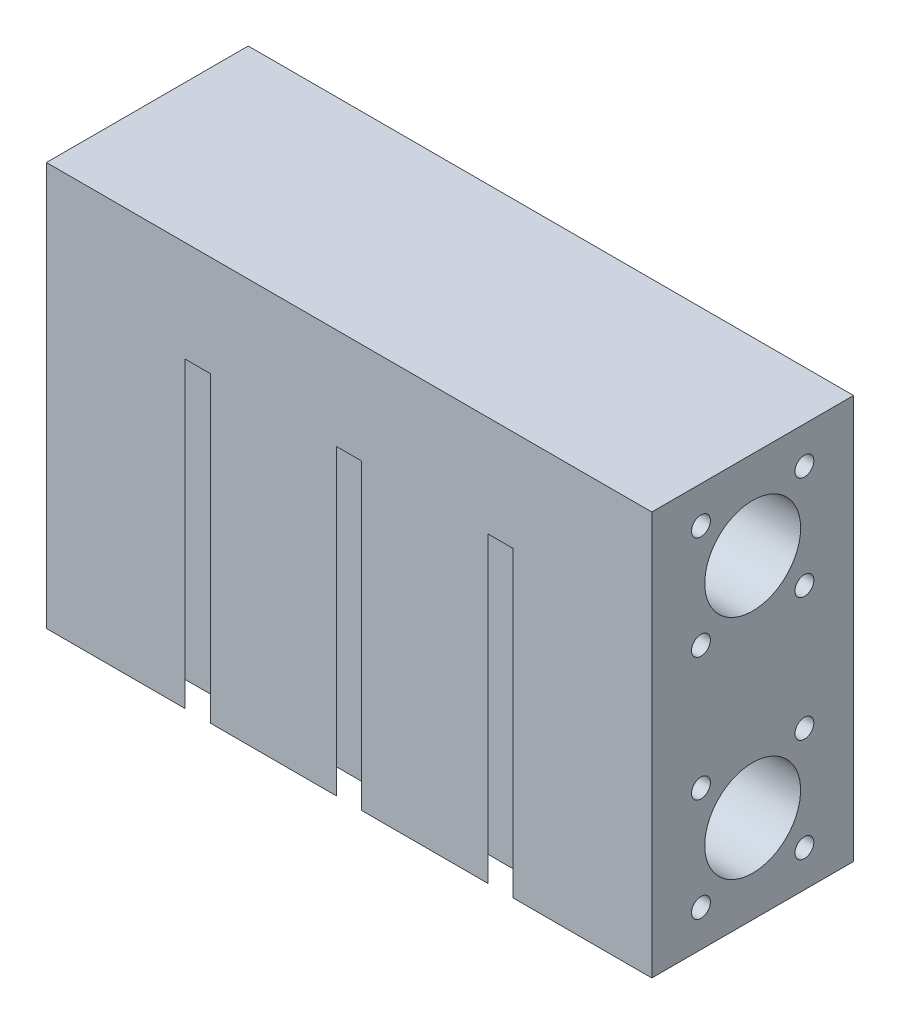
from build123d import *

# Parameters (mm, degrees)
SKETCH1_W                        = 120
SKETCH1_H                        = 80
BOSS_EXTRUDE1_DEPTH              = 40
SKETCH2_R                        = 1.85
LINEAR_BEARING_SCREW_CUTS_DEPTH  = 14
SKETCH3_R                        = 9.5
LINEAR_BEARINGS_HOLE_DEPTH       = 55
SKETCH4_R                        = 1.875
LINEAR_BEARING_SCREW_CUTS2_DEPTH = 14
CUT_EXTRUDE4_START               = -55
SKETCH5_R                        = 9.5
CUT_EXTRUDE4_DEPTH               = 55
CUT_EXTRUDE8_DEPTH               = 60


with BuildPart() as part:
    # Sketch1 → Boss-Extrude1 (new body)
    with BuildSketch(Plane.XY):
        with Locations((60, 40)):
            Rectangle(SKETCH1_W, SKETCH1_H)
    extrude(amount=BOSS_EXTRUDE1_DEPTH)

    # Sketch2 → linear-bearing-screw-cuts (cut)
    with BuildSketch(Plane.ZY):
        with Locations((30.25, 72.75)):
            Circle(SKETCH2_R)
        with Locations((9.75, 72.75)):
            Circle(SKETCH2_R)
        with Locations((30.25, 52.25)):
            Circle(SKETCH2_R)
        with Locations((9.75, 52.25)):
            Circle(SKETCH2_R)
        with Locations((9.75, 27.75)):
            Circle(SKETCH2_R)
        with Locations((30.25, 27.75)):
            Circle(SKETCH2_R)
        with Locations((30.25, 7.25)):
            Circle(SKETCH2_R)
        with Locations((9.75, 7.25)):
            Circle(SKETCH2_R)
    extrude(amount=-LINEAR_BEARING_SCREW_CUTS_DEPTH, mode=Mode.SUBTRACT)

    # Sketch3 → linear-bearings-hole (cut)
    with BuildSketch(Plane.ZY):
        with Locations((20, 62.5)):
            Circle(SKETCH3_R)
        with Locations((20, 17.5)):
            Circle(SKETCH3_R)
    extrude(amount=-LINEAR_BEARINGS_HOLE_DEPTH, mode=Mode.SUBTRACT)

    # Sketch4 → linear-bearing-screw-cuts2 (cut)
    with BuildSketch(Plane(origin=(120, 0, 0), x_dir=(0, 0, -1), z_dir=(1, 0, 0))):
        with Locations((-9.75, 72.75)):
            Circle(SKETCH4_R)
        with Locations((-30.25, 72.75)):
            Circle(SKETCH4_R)
        with Locations((-9.75, 52.25)):
            Circle(SKETCH4_R)
        with Locations((-30.25, 52.25)):
            Circle(SKETCH4_R)
        with Locations((-30.25, 27.75)):
            Circle(SKETCH4_R)
        with Locations((-9.75, 27.75)):
            Circle(SKETCH4_R)
        with Locations((-9.75, 7.25)):
            Circle(SKETCH4_R)
        with Locations((-30.25, 7.25)):
            Circle(SKETCH4_R)
    extrude(amount=-LINEAR_BEARING_SCREW_CUTS2_DEPTH, mode=Mode.SUBTRACT)

    # Sketch5 → Cut-Extrude4 (cut)
    with BuildSketch(Plane(origin=(120, 0, 0), x_dir=(0, 0, -1), z_dir=(1, 0, 0)).offset(CUT_EXTRUDE4_START)):
        with Locations((-20, 62.5)):
            Circle(SKETCH5_R)
        with Locations((-20, 17.5)):
            Circle(SKETCH5_R)
    extrude(amount=CUT_EXTRUDE4_DEPTH, mode=Mode.SUBTRACT)

    # Sketch10 → Cut-Extrude8 (cut)
    with BuildSketch(Plane.XZ):
        Polygon((87.5, 40), (82.5, 35), (97.5, 35), (92.5, 40), align=None)
        Polygon((52.5, 35), (57.5, 40), (62.5, 40), (67.5, 35), align=None)
        Polygon((22.5, 35), (27.5, 40), (32.5, 40), (37.5, 35), align=None)
    extrude(amount=-CUT_EXTRUDE8_DEPTH, mode=Mode.SUBTRACT)


solid = part.part
